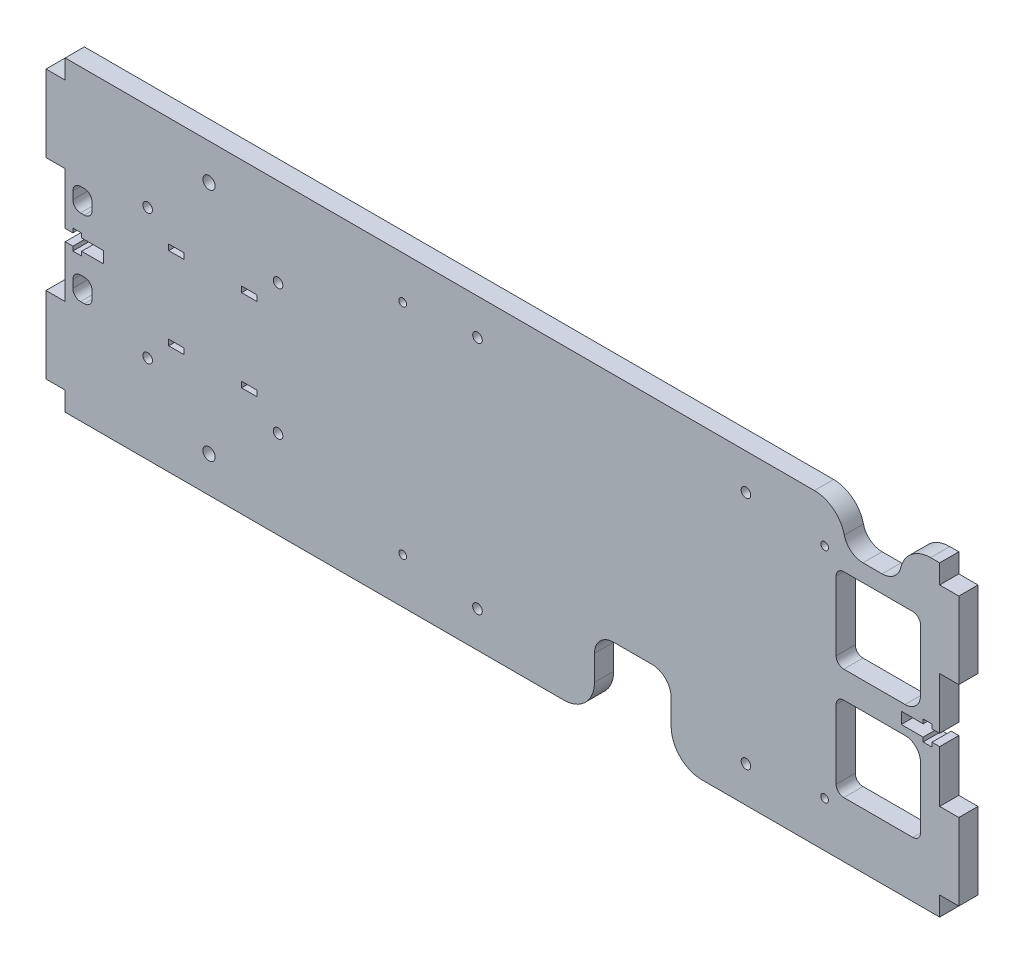
from build123d import *

# Parameters (mm, degrees)
ESQUISSE1_R        = 1
ESQUISSE1_R_2      = 1.25
ESQUISSE1_R_3      = 1.6
ESQUISSE1_W        = 4
ESQUISSE1_H        = 1.5
BOSS_EXTRU_1_DEPTH = 5
SKETCH1_R          = 1.25
SKETCH1_W          = 15
SKETCH1_H          = 10
SKETCH1_W_2        = 5
SKETCH1_H_2        = 6
SKETCH1_W_3        = 20
SKETCH1_H_3        = 20
SKETCH1_W_4        = 22
SKETCH1_H_4        = 22
CUT_EXTRUDE1_DEPTH = 10
FILLET2_R          = 5
FILLET3_R          = 2
CONG_1_R           = 8
CONG_2_R           = 2
CONG_3_R           = 4


with BuildPart() as part:
    # Esquisse1 → Boss.-Extru.1 (new body)
    with BuildSketch(Plane.XY):
        Polygon((0, 35), (0, 15), (5, 15), (5, 1.5), (7, 1.5), (7, 2.6), (9.3, 2.6), (9.3, 1.5), (15, 1.5), (15, -1.5), (9.3, -1.5), (9.3, -2.6), (7, -2.6), (7, -1.5), (5, -1.5), (5, -15), (0, -15), (0, -35), (5, -35), (5, -40), (233, -40), (233, -35), (238, -35), (238, -15), (233, -15), (233, -1.5), (231, -1.5), (231, -2.6), (228.7, -2.6), (228.7, -1.5), (223, -1.5), (223, 1.5), (228.7, 1.5), (228.7, 2.6), (231, 2.6), (231, 1.5), (233, 1.5), (233, 15), (238, 15), (238, 35), (233, 35), (233, 40), (5, 40), (5, 35), align=None)
        with Locations((203, -28.177197641)):
            Circle(ESQUISSE1_R, mode=Mode.SUBTRACT)
        with Locations((203, 28.822802359)):
            Circle(ESQUISSE1_R, mode=Mode.SUBTRACT)
        with Locations((93, -28.177197641)):
            Circle(ESQUISSE1_R, mode=Mode.SUBTRACT)
        with Locations((93, 28.822802359)):
            Circle(ESQUISSE1_R, mode=Mode.SUBTRACT)
        with Locations((112.5, -30.615)):
            Circle(ESQUISSE1_R_2, mode=Mode.SUBTRACT)
        with Locations((42.5, -30.615)):
            Circle(ESQUISSE1_R_3, mode=Mode.SUBTRACT)
        with Locations((182.5, -30.615)):
            Circle(ESQUISSE1_R_2, mode=Mode.SUBTRACT)
        with Locations((42.5, 30.615)):
            Circle(ESQUISSE1_R_3, mode=Mode.SUBTRACT)
        with Locations((182.5, 30.615)):
            Circle(ESQUISSE1_R_2, mode=Mode.SUBTRACT)
        with Locations((112.5, 30.615)):
            Circle(ESQUISSE1_R_2, mode=Mode.SUBTRACT)
        with Locations((34, -10.75)):
            Rectangle(ESQUISSE1_W, ESQUISSE1_H, mode=Mode.SUBTRACT)
        with Locations((34, 10.75)):
            Rectangle(ESQUISSE1_W, ESQUISSE1_H, mode=Mode.SUBTRACT)
        with Locations((53, 10.75)):
            Rectangle(ESQUISSE1_W, ESQUISSE1_H, mode=Mode.SUBTRACT)
        with Locations((53, -10.75)):
            Rectangle(ESQUISSE1_W, ESQUISSE1_H, mode=Mode.SUBTRACT)
    extrude(amount=BOSS_EXTRU_1_DEPTH)

    # Sketch1 → Cut-Extrude1 (cut)
    with BuildSketch(Plane(origin=(0, 0, 0), x_dir=(-1, 0, 0), z_dir=(0, 0, -1))):
        with Locations((-60.5, 17)):
            Circle(SKETCH1_R)
        with Locations((-60.5, -17)):
            Circle(SKETCH1_R)
        with Locations((-26.5, 17)):
            Circle(SKETCH1_R)
        with Locations((-26.5, -17)):
            Circle(SKETCH1_R)
        with Locations((-215.5, 35)):
            Rectangle(SKETCH1_W, SKETCH1_H)
        with Locations((-9.5, 10)):
            Rectangle(SKETCH1_W_2, SKETCH1_H_2)
        with Locations((-153, -30.429903646)):
            Rectangle(SKETCH1_W_3, SKETCH1_H_3)
        with Locations((-9.5, -10)):
            Rectangle(SKETCH1_W_2, SKETCH1_H_2)
        with Locations((-217, 14.5)):
            Rectangle(SKETCH1_W_4, SKETCH1_H_4)
        with Locations((-217, -14.5)):
            Rectangle(SKETCH1_W_4, SKETCH1_H_4)
    extrude(amount=-CUT_EXTRUDE1_DEPTH, mode=Mode.SUBTRACT)

    # Fillet2
    fillet2_edges = [part.edges().sort_by_distance(p)[0] for p in [
        (223, 30, 2.5),
        (208, 30, 2.5),
        (143, -20.429903646, 2.5),
        (163, -20.429903646, 2.5),
    ]]
    fillet(fillet2_edges, radius=FILLET2_R)

    # Fillet3
    fillet3_edges = [part.edges().sort_by_distance(p)[0] for p in [
        (228, -25.5, 2.5),
        (206, -3.5, 2.5),
        (206, -25.5, 2.5),
        (206, 3.5, 2.5),
        (228, 25.5, 2.5),
        (206, 25.5, 2.5),
    ]]
    fillet(fillet3_edges, radius=FILLET3_R)

    # Congé1
    cong_1_edges = [part.edges().sort_by_distance(p)[0] for p in [
        (223, 40, 2.5),
        (208, 40, 2.5),
        (163, -40, 2.5),
        (143, -40, 2.5),
    ]]
    fillet(cong_1_edges, radius=CONG_1_R)

    # Congé2
    cong_2_edges = [part.edges().sort_by_distance(p)[0] for p in [
        (7, -13, 2.5),
        (12, -13, 2.5),
        (7, -7, 2.5),
        (12, -7, 2.5),
        (12, 7, 2.5),
        (7, 7, 2.5),
        (7, 13, 2.5),
        (12, 13, 2.5),
    ]]
    fillet(cong_2_edges, radius=CONG_2_R)

    # Congé3
    cong_3_edges = [part.edges().sort_by_distance(p)[0] for p in [
        (228, 3.5, 2.5),
        (228, -3.5, 2.5),
    ]]
    fillet(cong_3_edges, radius=CONG_3_R)


solid = part.part
